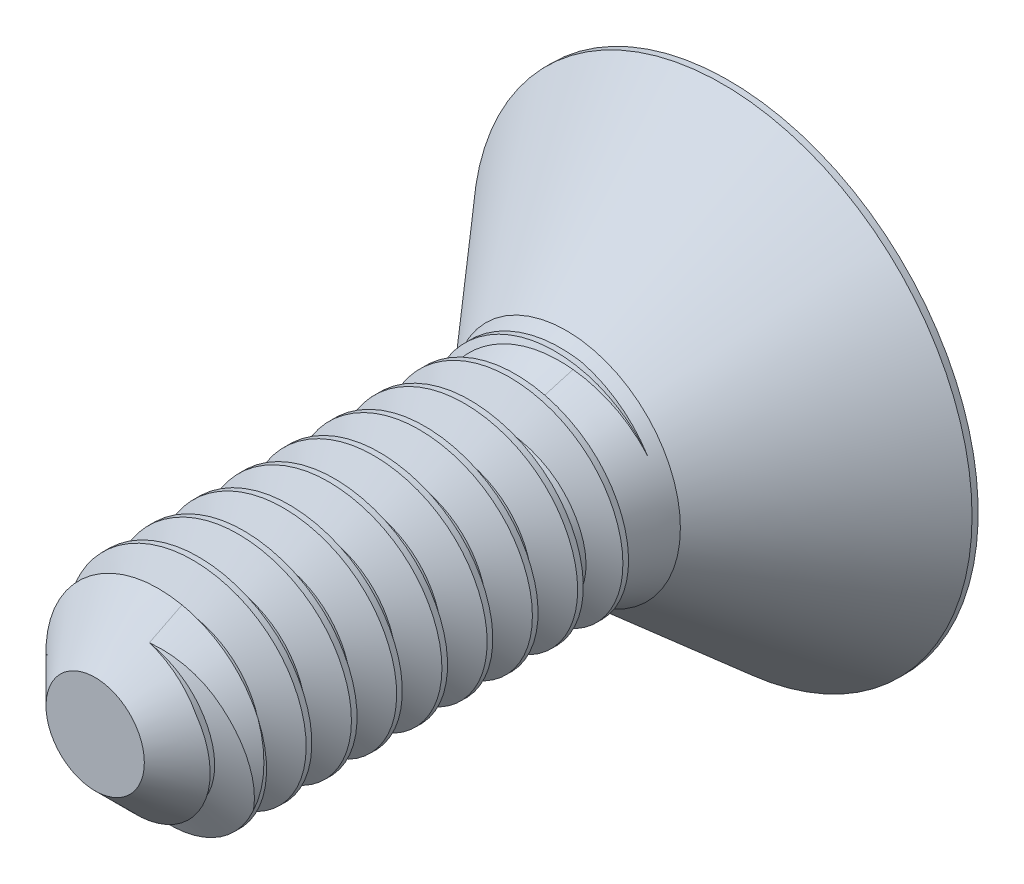
from build123d import *
from build123d.topology import SkipClean

# Parameters (mm, degrees)
SKETCH1_R          = 1.0922
EXTRUDE1_DEPTH     = 6.35
CUT_SWEEP1_PITCH   = 0.453571429
SKETCH6_R          = 2.5019
EXTRUDE2_DEPTH     = 1.6256
CUT_EXTRUDE1_DEPTH = 0.9525
SKETCH8_R          = 0.733234842
CUT_EXTRUDE2_DEPTH = 8.269216567
CUT_EXTRUDE2_TAPER = 45


with BuildPart() as part:
    # Sketch1 → Extrude1 (new body)
    with BuildSketch(Plane.XY):
        Circle(SKETCH1_R)
    extrude(amount=-EXTRUDE1_DEPTH)

    # Cut-Sweep1: the profile of Sketch3 profile screwed along a right-hand helix of 15 turns, 6 arcs to a turn; built about Z, then put on its axis
    cut_sweep1_z = Axis((0, 0, 0), (0, 0, 1))
    cut_sweep1_corners = [(1.0925, 0, -0.397048205), (0.797596715, 0, -0.226785714), (0.797596715, 0, -0.170089286), (1.0925, 0, 0.000173205)]
    with BuildLine(mode=Mode.PRIVATE) as cut_sweep1_profile:
        Line(cut_sweep1_corners[0], cut_sweep1_corners[1])
        Line(cut_sweep1_corners[1], cut_sweep1_corners[2])
        Line(cut_sweep1_corners[2], cut_sweep1_corners[3])
        Line(cut_sweep1_corners[3], cut_sweep1_corners[0])
    cut_sweep1_cap = Face(cut_sweep1_profile.wire())
    cut_sweep1_turn_angles = [0, 30, 60, 90, 120, 150, 180, 210, 240, 270, 300, 330, 360]
    cut_sweep1_turn_weights = [1, 0.8660254037844387, 1, 0.8660254037844387, 1, 0.8660254037844387, 1, 0.8660254037844387, 1, 0.8660254037844387, 1, 0.8660254037844387, 1]
    cut_sweep1_turn_rails = [Edge.make_bspline([Vector(p[0], p[1], 0).rotate(cut_sweep1_z, cut_sweep1_turn_angles[k]) / cut_sweep1_turn_weights[k] + Vector(0, 0, p[2] + CUT_SWEEP1_PITCH * cut_sweep1_turn_angles[k] / 360) for k in range(13)], [0, 0, 0, 1, 1, 2, 2, 3, 3, 4, 4, 5, 5, 6, 6, 6], 2, cut_sweep1_turn_weights) for p in cut_sweep1_corners]
    cut_sweep1_turn_sides = [Face.make_surface_from_curves(cut_sweep1_turn_rails[p[0]], cut_sweep1_turn_rails[p[1]]) for p in [(0, 1), (1, 2), (2, 3), (3, 0)]]
    cut_sweep1 = Plane(origin=(0, 0, 0), x_dir=(0, 1, 0), z_dir=(0, 0, -1)) * Solid(Shell([*[p.moved(Location((0, 0, CUT_SWEEP1_PITCH * i))) for i in range(15) for p in cut_sweep1_turn_sides], cut_sweep1_cap, cut_sweep1_cap.rotate(cut_sweep1_z, 5400).moved(Location((0, 0, CUT_SWEEP1_PITCH * 5400 / 360)))]))
    add(cut_sweep1, mode=Mode.SUBTRACT)

    # Sketch4 → Cut-Revolve1 (revolve, cut)
    with BuildSketch(Plane(origin=(0, 0, 0), x_dir=(0, 0, -1), z_dir=(1, 0, 0)), mode=Mode.PRIVATE) as cut_revolve1_sk:
        Polygon((0.599403285, 1.0922), (0, 0.492796715), (0, 1.0922), align=None)
    revolve(cut_revolve1_sk.sketch.rotate(Axis((0, 0, 0), (0, 0, -1)), 17.408409521), axis=Axis((0, 0, 0), (0, 0, -1)), mode=Mode.SUBTRACT)

    # Sketch6 → Extrude2 (add)
    with SkipClean():  # the faces are left unmerged after this step: merging them gives an invalid solid
        with BuildSketch(Plane(origin=(0, 0, -6.35), x_dir=(-1, 0, 0), z_dir=(0, 0, -1))):
            Circle(SKETCH6_R)
        extrude(amount=-EXTRUDE2_DEPTH)

    # Sketch10 → Cut-Revolve2 (revolve, cut)
    with SkipClean():  # the faces are left unmerged after this step: merging them gives an invalid solid
        with BuildSketch(Plane(origin=(0, 0, 0), x_dir=(0, 0, -1), z_dir=(1, 0, 0)), mode=Mode.PRIVATE) as cut_revolve2_sk:
            Polygon((6.288555923, -2.5019), (4.7244, -1.1422), (4.7244, -2.5019), align=None)
        revolve(cut_revolve2_sk.sketch.rotate(Axis((0, 0, 0), (0, 0, -1)), 270), axis=Axis((0, 0, 0), (0, 0, -1)), mode=Mode.SUBTRACT)

    # Sketch11 → Revolve1 (revolve)
    with SkipClean():  # the faces are left unmerged after this step: merging them gives an invalid solid
        with BuildSketch(Plane(origin=(0, 0, 0), x_dir=(0, 0, -1), z_dir=(1, 0, 0)), mode=Mode.PRIVATE) as revolve1_sk:
            Polygon((4.7244, -1.1422), (3.931866704, -0.797596715), (3.931866704, 0), (4.7244, 0), align=None)
        revolve(revolve1_sk.sketch.rotate(Axis((0, 0, 0), (0, 0, -1)), 194.02870689), axis=Axis((0, 0, 0), (0, 0, -1)))

    # Sketch7 → Cut-Extrude1 (cut)
    with SkipClean():  # the faces are left unmerged after this step: merging them gives an invalid solid
        with BuildSketch(Plane.XY.offset(-6.35)):
            Polygon((0, 0.733234842), (-0.635, 0.366617421), (-0.635, -0.366617421), (0, -0.733234842), (0.635, -0.366617421), (0.635, 0.366617421), align=None)
        extrude(amount=CUT_EXTRUDE1_DEPTH, mode=Mode.SUBTRACT)

    # Sketch8 → Cut-Extrude2 (cut, through all)
    with SkipClean():  # the faces are left unmerged after this step: merging them gives an invalid solid
        with BuildSketch(Plane.XY.offset(-6.35)):
            Circle(SKETCH8_R)
        extrude(amount=CUT_EXTRUDE2_DEPTH, taper=CUT_EXTRUDE2_TAPER, mode=Mode.SUBTRACT)


solid = part.part
